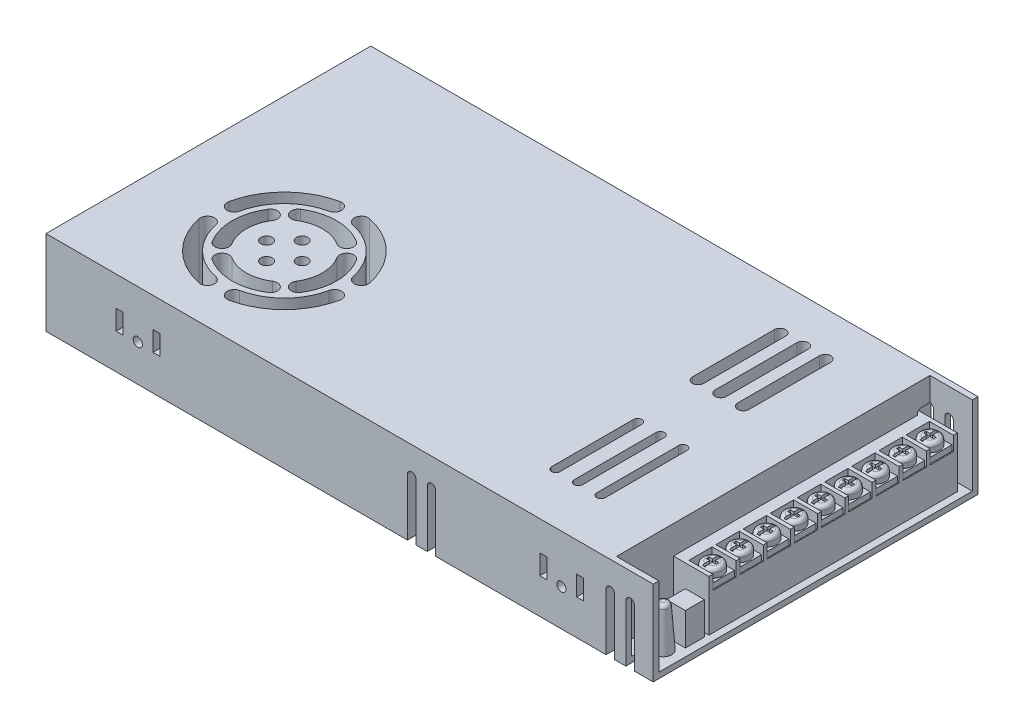
from build123d import *

# Parameters (mm, degrees)
CROQUIS1_W                         = 215
CROQUIS1_H                         = 115
SALIENTE_EXTRUIR1_DEPTH            = 30
CROQUIS2_W                         = 15
CROQUIS2_H                         = 111
CORTAR_EXTRUIR1_DEPTH              = 28
CROQUIS5_R                         = 1.625
CORTAR_EXTRUIR3_DEPTH              = 246.662369931
CORTAR_EXTRUIR5_DEPTH              = 28
CROQUIS10_W                        = 2.5
CROQUIS10_H                        = 7
CORTAR_EXTRUIR8_NO_CONFIRMAT_DEPTH = 246.662369931
CROQUIS11_W                        = 16
CROQUIS11_H                        = 88
SALIENTE_EXTRUIR2_DEPTH            = 20
CROQUIS12_W                        = 8.266666667
CROQUIS12_H                        = 5
CROQUIS12_W_2                      = 8.266666666
CORTAR_EXTRUIR11_DEPTH             = 8.5
CORTAR_EXTRUIR15_DEPTH             = 6.4
CUT_EXTRUDE2_START                 = -110
CUT_EXTRUDE2_DEPTH                 = 10
REDONDEO3_R                        = 1.3
CROQUIS18_R                        = 2
CORTAR_EXTRUIR17_DEPTH             = 28
CROQUIS28_R                        = 1.625
CORTAR_EXTRUIR23_DEPTH             = 2
CROQUIS29_R                        = 3.5
SALIENTE_EXTRUIR3_DEPTH            = 5
REDONDEO4_R                        = 1.3
CROQUIS30_W                        = 1
CROQUIS30_H                        = 6
CORTAR_EXTRUIR24_DEPTH             = 1
CROQUIS31_W                        = 3.5
CROQUIS31_H                        = 1
CORTAR_EXTRUIR25_DEPTH             = 1
CROQUIS32_W                        = 7.8
CROQUIS32_H                        = 7.8
SALIENTE_EXTRUIR4_DEPTH            = 2
MATRIZL1_COUNT                     = 9
MATRIZL1_PITCH                     = 9.62
CROQUIS34_W                        = 6.7
CROQUIS34_H                        = 6.7
SALIENTE_EXTRUIR5_DEPTH            = 11.5
CROQUIS35_R                        = 3
SALIENTE_EXTRUIR6_DEPTH            = 15
SALIENTE_EXTRUIR6_TAPER            = 4
REDONDEO5_R                        = 1.3


with BuildPart() as part:
    # Croquis1 → Saliente-Extruir1 (new body)
    with BuildSketch(Plane(origin=(0, 0, 0), x_dir=(1, 0, 0), z_dir=(0, 1, 0))):
        with Locations((107.5, 57.5)):
            Rectangle(CROQUIS1_W, CROQUIS1_H)
    extrude(amount=SALIENTE_EXTRUIR1_DEPTH)

    # Croquis2 → Cortar-Extruir1 (cut)
    with BuildSketch(Plane(origin=(0, 30, 0), x_dir=(1, 0, 0), z_dir=(0, 1, 0))):
        with Locations((207.5, 57.5)):
            Rectangle(CROQUIS2_W, CROQUIS2_H)
    extrude(amount=-CORTAR_EXTRUIR1_DEPTH, mode=Mode.SUBTRACT)

    # Croquis5 → Cortar-Extruir3 (cut, through all)
    with BuildSketch(Plane(origin=(0, 0, -115), x_dir=(-1, 0, 0), z_dir=(0, 0, -1))):
        with Locations((-182.5, 13)):
            Circle(CROQUIS5_R)
        with Locations((-32.5, 13)):
            Circle(CROQUIS5_R)
    extrude(amount=-CORTAR_EXTRUIR3_DEPTH, mode=Mode.SUBTRACT)

    # Croquis7 → Cortar-Extruir5 (cut)
    with BuildSketch(Plane(origin=(0, 30, 0), x_dir=(1, 0, 0), z_dir=(0, 1, 0))):
        with BuildLine():
            Line((178.4, 99.5), (178.4, 70.5))
            ThreePointArc((178.4, 70.5), (176.4, 68.5), (174.4, 70.5))
            Line((174.4, 70.5), (174.4, 99.5))
            ThreePointArc((174.4, 99.5), (176.4, 101.5), (178.4, 99.5))
        make_face()
        with BuildLine():
            Line((180, 47), (180, 18))
            ThreePointArc((180, 18), (178.5, 16.5), (177, 18))
            Line((177, 18), (177, 47))
            ThreePointArc((177, 47), (178.5, 48.5), (180, 47))
        make_face()
        with BuildLine():
            Line((170.4, 99.5), (170.4, 70.5))
            ThreePointArc((170.4, 70.5), (168.4, 68.5), (166.4, 70.5))
            Line((166.4, 70.5), (166.4, 99.5))
            ThreePointArc((166.4, 99.5), (168.4, 101.5), (170.4, 99.5))
        make_face()
        with BuildLine():
            Line((172, 47), (172, 18))
            ThreePointArc((172, 18), (170.5, 16.5), (169, 18))
            Line((169, 18), (169, 47))
            ThreePointArc((169, 47), (170.5, 48.5), (172, 47))
        make_face()
        with BuildLine():
            Line((162.4, 99.5), (162.4, 70.5))
            ThreePointArc((162.4, 70.5), (160.4, 68.5), (158.4, 70.5))
            Line((158.4, 70.5), (158.4, 99.5))
            ThreePointArc((158.4, 99.5), (160.4, 101.5), (162.4, 99.5))
        make_face()
        with BuildLine():
            Line((164, 47), (164, 18))
            ThreePointArc((164, 18), (162.5, 16.5), (161, 18))
            Line((161, 18), (161, 47))
            ThreePointArc((161, 47), (162.5, 48.5), (164, 47))
        make_face()
    extrude(amount=-CORTAR_EXTRUIR5_DEPTH, mode=Mode.SUBTRACT)

    # Croquis10 → Cortar-Extruir8 (no confirmat) (cut, through all)
    with BuildSketch(Plane(origin=(0, 0, -115), x_dir=(-1, 0, 0), z_dir=(0, 0, -1))):
        with Locations((-26.1, 16)):
            Rectangle(CROQUIS10_W, CROQUIS10_H)
        with Locations((-39.1, 16)):
            Rectangle(CROQUIS10_W, CROQUIS10_H)
        with Locations((-176.1, 16)):
            Rectangle(CROQUIS10_W, CROQUIS10_H)
        with Locations((-189.1, 16)):
            Rectangle(CROQUIS10_W, CROQUIS10_H)
    extrude(amount=-CORTAR_EXTRUIR8_NO_CONFIRMAT_DEPTH, mode=Mode.SUBTRACT)

    # Croquis17 → Cortar-Extruir15 (cut)
    with BuildSketch(Plane(origin=(0, 0, -115), x_dir=(-1, 0, 0), z_dir=(0, 0, -1))):
        with BuildLine():
            Line((-135, 20.2), (-135, 0))
            ThreePointArc((-135, 0), (-136.5, -1.5), (-138, 0))
            Line((-138, 0), (-138, 20.2))
            ThreePointArc((-138, 20.2), (-136.5, 21.7), (-135, 20.2))
        make_face()
        with BuildLine():
            Line((-128, 20.2), (-128, 0))
            ThreePointArc((-128, 0), (-129.5, -1.5), (-131, 0))
            Line((-131, 0), (-131, 20.2))
            ThreePointArc((-131, 20.2), (-129.5, 21.7), (-128, 20.2))
        make_face()
        with BuildLine():
            Line((-201.3, 0), (-201.3, 20.2))
            ThreePointArc((-201.3, 20.2), (-199.8, 21.7), (-198.3, 20.2))
            Line((-198.3, 20.2), (-198.3, 0))
            ThreePointArc((-198.3, 0), (-199.8, -1.5), (-201.3, 0))
        make_face()
        with BuildLine():
            Line((-208.3, 0), (-208.3, 20.2))
            ThreePointArc((-208.3, 20.2), (-206.8, 21.7), (-205.3, 20.2))
            Line((-205.3, 20.2), (-205.3, 0))
            ThreePointArc((-205.3, 0), (-206.8, -1.5), (-208.3, 0))
        make_face()
    extrude(amount=-CORTAR_EXTRUIR15_DEPTH, mode=Mode.SUBTRACT)

    # Croquis17<2> → Cut-Extrude2 (cut)
    with BuildSketch(Plane(origin=(0, 0, -115), x_dir=(-1, 0, 0), z_dir=(0, 0, -1)).offset(CUT_EXTRUDE2_START)):
        with BuildLine():
            Line((-135, 20.2), (-135, 0))
            ThreePointArc((-135, 0), (-136.5, -1.5), (-138, 0))
            Line((-138, 0), (-138, 20.2))
            ThreePointArc((-138, 20.2), (-136.5, 21.7), (-135, 20.2))
        make_face()
        with BuildLine():
            Line((-128, 20.2), (-128, 0))
            ThreePointArc((-128, 0), (-129.5, -1.5), (-131, 0))
            Line((-131, 0), (-131, 20.2))
            ThreePointArc((-131, 20.2), (-129.5, 21.7), (-128, 20.2))
        make_face()
        with BuildLine():
            Line((-201.3, 0), (-201.3, 20.2))
            ThreePointArc((-201.3, 20.2), (-199.8, 21.7), (-198.3, 20.2))
            Line((-198.3, 20.2), (-198.3, 0))
            ThreePointArc((-198.3, 0), (-199.8, -1.5), (-201.3, 0))
        make_face()
        with BuildLine():
            Line((-208.3, 0), (-208.3, 20.2))
            ThreePointArc((-208.3, 20.2), (-206.8, 21.7), (-205.3, 20.2))
            Line((-205.3, 20.2), (-205.3, 0))
            ThreePointArc((-205.3, 0), (-206.8, -1.5), (-208.3, 0))
        make_face()
    extrude(amount=-CUT_EXTRUDE2_DEPTH, mode=Mode.SUBTRACT)

    # Redondeo3
    redondeo3_edges = [part.edges().sort_by_distance(p)[0] for p in [
        (128, 10.1, -5),
        (129.5, 21.7, -5),
        (131, 10.1, -5),
        (135, 10.1, -5),
        (136.5, 21.7, -5),
        (138, 10.1, -5),
        (198.3, 10.1, -5),
        (198.812579117, 21.329158979, -5),
        (201.3, 1, -5),
        (205.3, 1, -5),
        (208.3, 1, -5),
        (128, 10.1, -108.6),
        (129.5, 21.7, -108.6),
        (131, 10.1, -108.6),
        (135, 10.1, -108.6),
        (136.5, 21.7, -108.6),
        (138, 10.1, -108.6),
        (198.3, 10.1, -108.6),
        (198.812579117, 21.329158979, -108.6),
        (201.3, 1, -108.6),
        (205.3, 1, -108.6),
        (208.3, 1, -108.6),
    ]]
    fillet(redondeo3_edges, radius=REDONDEO3_R - 0.0001)  # a hair under: the kernel refuses the full size

    # Croquis18 → Cortar-Extruir17 (cut)
    with BuildSketch(Plane(origin=(0, 30, 0), x_dir=(1, 0, 0), z_dir=(0, 1, 0))):
        with Locations(Location((41.2, 36.9, 0), (0, 0, 270))):
            Circle(CROQUIS18_R)
        with Locations(Location((47.5, 43.2, 0), (0, 0, 270))):
            Circle(CROQUIS18_R)
        with Locations(Location((53.8, 36.9, 0), (0, 0, 270))):
            Circle(CROQUIS18_R)
        with Locations(Location((47.5, 30.6, 0), (0, 0, 270))):
            Circle(CROQUIS18_R)
        with BuildLine():
            ThreePointArc((42.233695652, 61.850271311), (29.46877708, 54.93122292), (22.549728689, 42.166304348))
            ThreePointArc((22.549728689, 42.166304348), (24.479529404, 39.203894963), (27.441938763, 41.133695717))
            ThreePointArc((27.441938763, 41.133695717), (33.004311009, 51.395689038), (43.266304348, 56.95806125))
            ThreePointArc((43.266304348, 56.95806125), (45.196105031, 59.920470629), (42.233695652, 61.850271311))
        make_face()
        with BuildLine():
            ThreePointArc((67.55806125, 41.133695652), (61.995689038, 51.395688991), (51.733695717, 56.958061237))
            ThreePointArc((51.733695717, 56.958061237), (49.803894963, 59.920470596), (52.766304348, 61.850271311))
            ThreePointArc((52.766304348, 61.850271311), (65.53122292, 54.93122292), (72.450271311, 42.166304348))
            ThreePointArc((72.450271311, 42.166304348), (70.520470629, 39.203894969), (67.55806125, 41.133695652))
        make_face()
        with BuildLine():
            ThreePointArc((51.733695652, 16.84193875), (61.995688991, 22.404310962), (67.558061237, 32.666304283))
            ThreePointArc((67.558061237, 32.666304283), (70.520470596, 34.596105037), (72.450271311, 31.633695652))
            ThreePointArc((72.450271311, 31.633695652), (65.53122292, 18.86877708), (52.766304348, 11.949728689))
            ThreePointArc((52.766304348, 11.949728689), (49.803894969, 13.879529371), (51.733695652, 16.84193875))
        make_face()
        with BuildLine():
            ThreePointArc((27.44193875, 32.666304348), (33.004310962, 22.404311009), (43.266304283, 16.841938763))
            ThreePointArc((43.266304283, 16.841938763), (45.196105037, 13.879529404), (42.233695652, 11.949728689))
            ThreePointArc((42.233695652, 11.949728689), (29.46877708, 18.86877708), (22.549728689, 31.633695652))
            ThreePointArc((22.549728689, 31.633695652), (24.479529371, 34.596105031), (27.44193875, 32.666304348))
        make_face()
        with BuildLine():
            ThreePointArc((31.873772868, 46.803081622), (29, 36.9), (31.873772868, 26.996918378))
            ThreePointArc((31.873772868, 26.996918378), (35.323679456, 26.223520336), (36.097077498, 29.673426924))
            ThreePointArc((36.097077498, 29.673426924), (34, 36.9), (36.097077498, 44.126573076))
            ThreePointArc((36.097077498, 44.126573076), (35.323679456, 47.576479664), (31.873772868, 46.803081622))
        make_face()
        with BuildLine():
            ThreePointArc((57.403081622, 52.526227132), (47.5, 55.4), (37.596918378, 52.526227132))
            ThreePointArc((37.596918378, 52.526227132), (36.823520336, 49.076320544), (40.273426924, 48.302922502))
            ThreePointArc((40.273426924, 48.302922502), (47.5, 50.4), (54.726573076, 48.302922502))
            ThreePointArc((54.726573076, 48.302922502), (58.176479664, 49.076320544), (57.403081622, 52.526227132))
        make_face()
        with BuildLine():
            ThreePointArc((63.126227132, 26.996918378), (66, 36.9), (63.126227132, 46.803081622))
            ThreePointArc((63.126227132, 46.803081622), (59.676320544, 47.576479664), (58.902922502, 44.126573076))
            ThreePointArc((58.902922502, 44.126573076), (61, 36.9), (58.902922502, 29.673426924))
            ThreePointArc((58.902922502, 29.673426924), (59.676320544, 26.223520336), (63.126227132, 26.996918378))
        make_face()
        with BuildLine():
            ThreePointArc((37.596918378, 21.273772868), (47.5, 18.4), (57.403081622, 21.273772868))
            ThreePointArc((57.403081622, 21.273772868), (58.176479664, 24.723679456), (54.726573076, 25.497077498))
            ThreePointArc((54.726573076, 25.497077498), (47.5, 23.4), (40.273426924, 25.497077498))
            ThreePointArc((40.273426924, 25.497077498), (36.823520336, 24.723679456), (37.596918378, 21.273772868))
        make_face()
    extrude(amount=-CORTAR_EXTRUIR17_DEPTH, mode=Mode.SUBTRACT)

    # Croquis28 → Cortar-Extruir23 (cut)
    with BuildSketch(Plane.XZ):
        with Locations(Location((32.5, -32.5, 0), (0, 0, 270))):
            Circle(CROQUIS28_R)
        with Locations(Location((32.5, -82.5, 0), (0, 0, 270))):
            Circle(CROQUIS28_R)
        with Locations(Location((182.5, -32.5, 0), (0, 0, 270))):
            Circle(CROQUIS28_R)
        with Locations(Location((182.5, -82.5, 0), (0, 0, 270))):
            Circle(CROQUIS28_R)
    extrude(amount=-CORTAR_EXTRUIR23_DEPTH, mode=Mode.SUBTRACT)


with BuildPart() as body_2:
    # Croquis11 → Saliente-Extruir2 (new body)
    with BuildSketch(Plane(origin=(0, 0, 0), x_dir=(1, 0, 0), z_dir=(0, 1, 0))):
        with Locations((204.5, 66.2)):
            Rectangle(CROQUIS11_W, CROQUIS11_H)
    extrude(amount=SALIENTE_EXTRUIR2_DEPTH)

    # Croquis12 → Cortar-Extruir11 (cut)
    with BuildSketch(Plane(origin=(212.5, 0, 0), x_dir=(0, 0, -1), z_dir=(1, 0, 0))):
        with Locations((27.733333333, 17.5)):
            Rectangle(CROQUIS12_W, CROQUIS12_H)
        with Locations((37.35, 17.5)):
            Rectangle(CROQUIS12_W_2, CROQUIS12_H)
        with Locations((46.966666667, 17.5)):
            Rectangle(CROQUIS12_W, CROQUIS12_H)
        with Locations((56.583333334, 17.5)):
            Rectangle(CROQUIS12_W, CROQUIS12_H)
        with Locations((66.2, 17.5)):
            Rectangle(CROQUIS12_W_2, CROQUIS12_H)
        with Locations((75.816666666, 17.5)):
            Rectangle(CROQUIS12_W, CROQUIS12_H)
        with Locations((85.433333334, 17.5)):
            Rectangle(CROQUIS12_W, CROQUIS12_H)
        with Locations((95.05, 17.5)):
            Rectangle(CROQUIS12_W_2, CROQUIS12_H)
        with Locations((104.666666667, 17.5)):
            Rectangle(CROQUIS12_W, CROQUIS12_H)
    extrude(amount=-CORTAR_EXTRUIR11_DEPTH, mode=Mode.SUBTRACT)


with BuildPart() as body_3:
    # Croquis29 → Saliente-Extruir3 (new body)
    with BuildSketch(Plane(origin=(0, 15, 0), x_dir=(1, 0, 0), z_dir=(0, 1, 0))):
        with Locations(Location((208.25, 27.733333333, 0), (0, 0, 270))):
            Circle(CROQUIS29_R)
    extrude(amount=SALIENTE_EXTRUIR3_DEPTH)

    # Redondeo4
    redondeo4_edges = [body_3.edges().sort_by_distance(p)[0] for p in [
        (208.25, 20, -31.233333333),
    ]]
    fillet(redondeo4_edges, radius=REDONDEO4_R)

    # Croquis30 → Cortar-Extruir24 (cut)
    with BuildSketch(Plane(origin=(0, 20, 0), x_dir=(1, 0, 0), z_dir=(0, 1, 0))):
        with Locations((208.25, 27.733333333)):
            Rectangle(CROQUIS30_W, CROQUIS30_H)
    extrude(amount=-CORTAR_EXTRUIR24_DEPTH, mode=Mode.SUBTRACT)

    # Croquis31 → Cortar-Extruir25 (cut)
    with BuildSketch(Plane(origin=(0, 20, 0), x_dir=(1, 0, 0), z_dir=(0, 1, 0))):
        with Locations((208.25, 27.733333333)):
            Rectangle(CROQUIS31_W, CROQUIS31_H)
    extrude(amount=-CORTAR_EXTRUIR25_DEPTH, mode=Mode.SUBTRACT)

    # Croquis32 → Saliente-Extruir4 (add)
    with BuildSketch(Plane(origin=(0, 15, 0), x_dir=(1, 0, 0), z_dir=(0, 1, 0))):
        with Locations((208.25, 27.733333333)):
            Rectangle(CROQUIS32_W, CROQUIS32_H)
    extrude(amount=SALIENTE_EXTRUIR4_DEPTH)


with BuildPart() as matrizl1_1:
    # MatrizL1: pattern copy
    add(body_3.part.moved(Location(Vector(0, 0, -1) * (1 * MATRIZL1_PITCH))))


with BuildPart() as matrizl1_2:
    # MatrizL1: pattern copy
    add(body_3.part.moved(Location(Vector(0, 0, -1) * (2 * MATRIZL1_PITCH))))


with BuildPart() as matrizl1_3:
    # MatrizL1: pattern copy
    add(body_3.part.moved(Location(Vector(0, 0, -1) * (3 * MATRIZL1_PITCH))))


with BuildPart() as matrizl1_4:
    # MatrizL1: pattern copy
    add(body_3.part.moved(Location(Vector(0, 0, -1) * (4 * MATRIZL1_PITCH))))


with BuildPart() as matrizl1_5:
    # MatrizL1: pattern copy
    add(body_3.part.moved(Location(Vector(0, 0, -1) * (5 * MATRIZL1_PITCH))))


with BuildPart() as matrizl1_6:
    # MatrizL1: pattern copy
    add(body_3.part.moved(Location(Vector(0, 0, -1) * (6 * MATRIZL1_PITCH))))


with BuildPart() as matrizl1_7:
    # MatrizL1: pattern copy
    add(body_3.part.moved(Location(Vector(0, 0, -1) * (7 * MATRIZL1_PITCH))))


with BuildPart() as matrizl1_8:
    # MatrizL1: pattern copy
    add(body_3.part.moved(Location(Vector(0, 0, -1) * (8 * MATRIZL1_PITCH))))


with BuildPart() as body_12:
    # Croquis34 → Saliente-Extruir5 (new body)
    with BuildSketch(Plane(origin=(0, 2, 0), x_dir=(1, 0, 0), z_dir=(0, 1, 0))):
        with Locations((208.95, 17.45)):
            Rectangle(CROQUIS34_W, CROQUIS34_H)
    extrude(amount=SALIENTE_EXTRUIR5_DEPTH)


with BuildPart() as body_13:
    # Croquis35 → Saliente-Extruir6 (new body)
    with BuildSketch(Plane(origin=(0, 2, 0), x_dir=(1, 0, 0), z_dir=(0, 1, 0))):
        with Locations((208.95, 9.6)):
            Circle(CROQUIS35_R)
    extrude(amount=SALIENTE_EXTRUIR6_DEPTH, taper=SALIENTE_EXTRUIR6_TAPER)

    # Redondeo5
    redondeo5_edges = [body_13.edges().sort_by_distance(p)[0] for p in [
        (206.998902179, 17, -9.6),
    ]]
    fillet(redondeo5_edges, radius=REDONDEO5_R)


solid = Compound([part.part, body_2.part, body_3.part, matrizl1_1.part, matrizl1_2.part, matrizl1_3.part, matrizl1_4.part, matrizl1_5.part, matrizl1_6.part, matrizl1_7.part, matrizl1_8.part, body_12.part, body_13.part])
